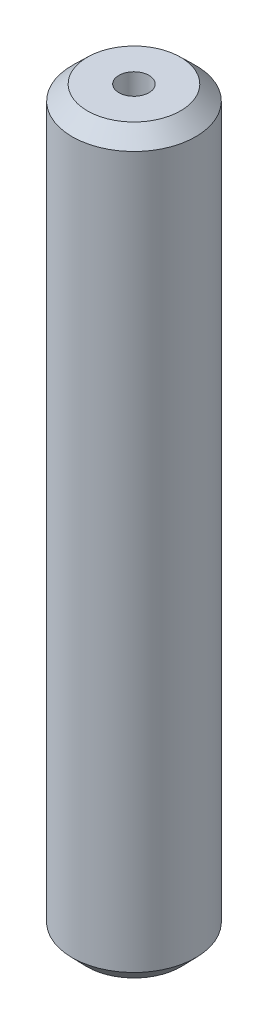
from build123d import *
from OCP.BRepFilletAPI import BRepFilletAPI_MakeChamfer

# Parameters (mm, degrees)
SKETCH1_R           = 5
BOSS_EXTRUDE1_DEPTH = 59.967826089
SKETCH2_R           = 1.217893098
CUT_EXTRUDE1_DEPTH  = 61.383277203
CHAMFER1_SIZE       = 1.19556177
CHAMFER1_SIZE2      = 1.231586661


with BuildPart() as part:
    # Sketch1 → Boss-Extrude1 (new body)
    with BuildSketch(Plane(origin=(0, 0, 0), x_dir=(1, 0, 0), z_dir=(0, 1, 0))):
        Circle(SKETCH1_R)
    extrude(amount=BOSS_EXTRUDE1_DEPTH)

    # Sketch2 → Cut-Extrude1 (cut, through all)
    with BuildSketch(Plane(origin=(0, 0, 0), x_dir=(1, 0, 0), z_dir=(0, 1, 0))):
        Circle(SKETCH2_R)
    extrude(amount=CUT_EXTRUDE1_DEPTH, mode=Mode.SUBTRACT)

    # Chamfer1: one chamfer whose edges measure the first distance from different faces: ONE call of the kernel's chamfer builder (chamfer() names one face for all edges)
    chamfer1_edges_1 = [part.edges().sort_by_distance(p)[0] for p in [
        (-5, 59.967826089, 0),
    ]]
    chamfer1_side_1 = [part.faces().sort_by_distance(p)[0] for p in [
        (-5, 29.983913044, 0),
    ]]
    chamfer1_edges_2 = [part.edges().sort_by_distance(p)[0] for p in [
        (-5, 0, 0),
    ]]
    chamfer1_side_2 = [part.faces().sort_by_distance(p)[0] for p in [
        (-4.858578644, 0, 0),
    ]]
    chamfer1 = BRepFilletAPI_MakeChamfer(part.part.solid().wrapped)
    for e in chamfer1_edges_1:
        chamfer1.Add(CHAMFER1_SIZE, CHAMFER1_SIZE2, e.wrapped, chamfer1_side_1[0].wrapped)  # the first distance lies on this face
    for e in chamfer1_edges_2:
        chamfer1.Add(CHAMFER1_SIZE, CHAMFER1_SIZE2, e.wrapped, chamfer1_side_2[0].wrapped)  # the first distance lies on this face
    add(Compound.cast(chamfer1.Shape()), mode=Mode.REPLACE)


solid = part.part
